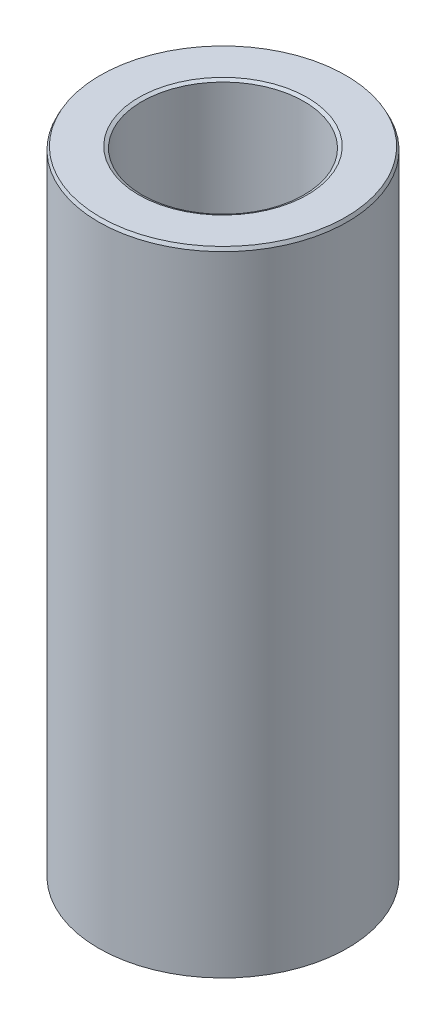
from build123d import *
from OCP.BRepFilletAPI import BRepFilletAPI_MakeChamfer

# Parameters (mm, degrees)
SKETCH1_R           = 30
BOSS_EXTRUDE1_DEPTH = 152.786120747
SKETCH2_R           = 19.519250039
CUT_EXTRUDE1_DEPTH  = 159.567331733
CHAMFER1_SIZE       = 0.805826284
CHAMFER1_SIZE2      = 0.410165066


with BuildPart() as part:
    # Sketch1 → Boss-Extrude1 (new body)
    with BuildSketch(Plane(origin=(0, 0, 0), x_dir=(1, 0, 0), z_dir=(0, 1, 0))):
        Circle(SKETCH1_R)
    extrude(amount=BOSS_EXTRUDE1_DEPTH)

    # Sketch2 → Cut-Extrude1 (cut, through all)
    with BuildSketch(Plane(origin=(0, 0, 0), x_dir=(1, 0, 0), z_dir=(0, 1, 0))):
        Circle(SKETCH2_R)
    extrude(amount=CUT_EXTRUDE1_DEPTH, mode=Mode.SUBTRACT)

    # Chamfer1: one chamfer whose edges measure the first distance from different faces: ONE call of the kernel's chamfer builder (chamfer() names one face for all edges)
    chamfer1_edges_1 = [part.edges().sort_by_distance(p)[0] for p in [
        (-19.519250039, 152.786120747, 0),
    ]]
    chamfer1_side_1 = [part.faces().sort_by_distance(p)[0] for p in [
        (-29.151471863, 152.786120747, 0),
    ]]
    chamfer1_edges_2 = [part.edges().sort_by_distance(p)[0] for p in [
        (-19.519250039, 0, 0),
    ]]
    chamfer1_side_2 = [part.faces().sort_by_distance(p)[0] for p in [
        (-19.519250039, 76.393060374, 0),
    ]]
    chamfer1_edges_3 = [part.edges().sort_by_distance(p)[0] for p in [
        (-30, 0, 0),
    ]]
    chamfer1_side_3 = [part.faces().sort_by_distance(p)[0] for p in [
        (-29.151471863, 0, 0),
    ]]
    chamfer1_edges_4 = [part.edges().sort_by_distance(p)[0] for p in [
        (-30, 152.786120747, 0),
    ]]
    chamfer1_side_4 = [part.faces().sort_by_distance(p)[0] for p in [
        (-30, 76.393060374, 0),
    ]]
    chamfer1 = BRepFilletAPI_MakeChamfer(part.part.solid().wrapped)
    for e in chamfer1_edges_1:
        chamfer1.Add(CHAMFER1_SIZE, CHAMFER1_SIZE2, e.wrapped, chamfer1_side_1[0].wrapped)  # the first distance lies on this face
    for e in chamfer1_edges_2:
        chamfer1.Add(CHAMFER1_SIZE, CHAMFER1_SIZE2, e.wrapped, chamfer1_side_2[0].wrapped)  # the first distance lies on this face
    for e in chamfer1_edges_3:
        chamfer1.Add(CHAMFER1_SIZE, CHAMFER1_SIZE2, e.wrapped, chamfer1_side_3[0].wrapped)  # the first distance lies on this face
    for e in chamfer1_edges_4:
        chamfer1.Add(CHAMFER1_SIZE, CHAMFER1_SIZE2, e.wrapped, chamfer1_side_4[0].wrapped)  # the first distance lies on this face
    add(Compound.cast(chamfer1.Shape()), mode=Mode.REPLACE)


solid = part.part
